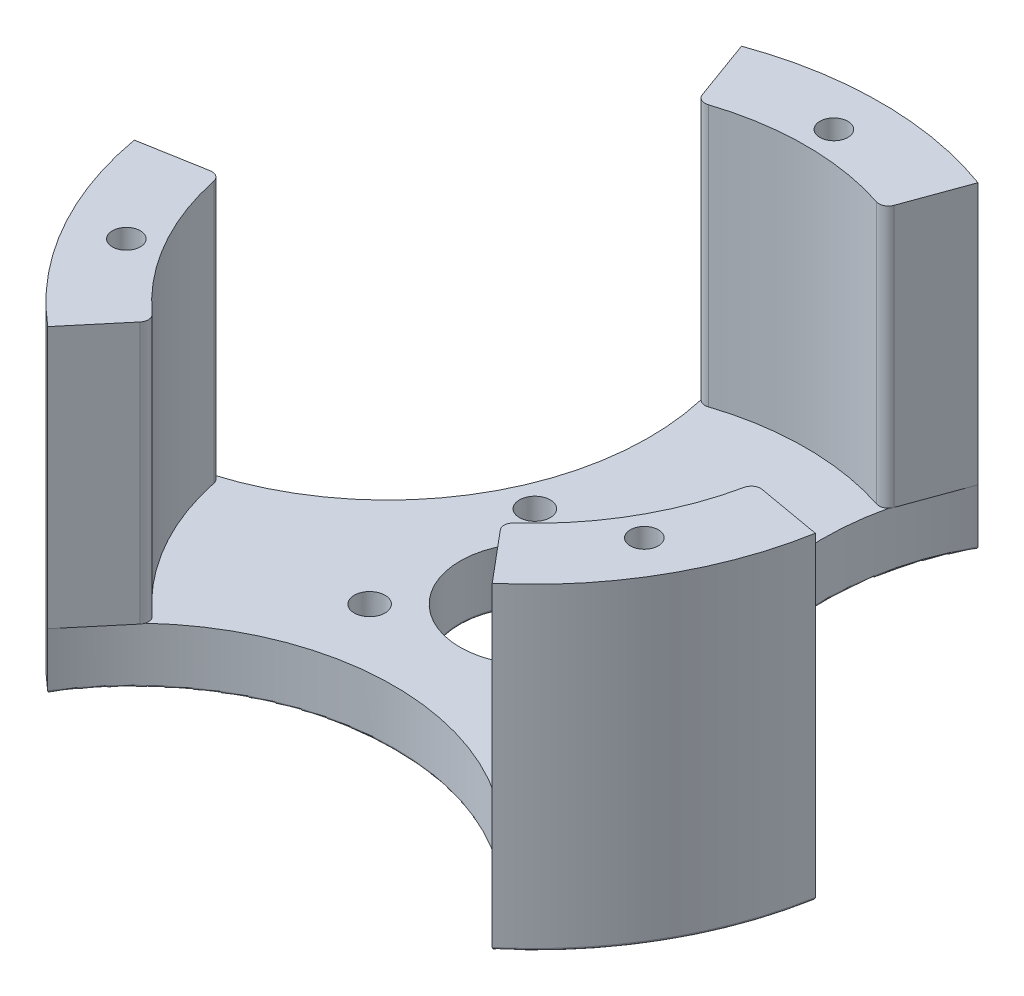
from build123d import *

# Parameters (mm, degrees)
SKETCH1_R           = 37
SKETCH1_R_2         = 1.65
BOSS_EXTRUDE1_DEPTH = 6
SKETCH2_R           = 1.5
BOSS_EXTRUDE2_DEPTH = 28
SKETCH16_R          = 1.5
CUT_EXTRUDE9_DEPTH  = 63.401923047
CIRPATTERN1_COUNT   = 3
SKETCH3_R           = 8
CUT_EXTRUDE1_DEPTH  = 10
SKETCH4_R           = 3.5
CUT_EXTRUDE2_DEPTH  = 3
SKETCH5_R           = 27.977706125
CUT_EXTRUDE3_DEPTH  = 60.3464405
CIRPATTERN2_COUNT   = 3
FILLET1_R           = 0.25
FILLET2_R           = 1


with BuildPart() as part:
    # Sketch1 → Boss-Extrude1 (new body)
    with BuildSketch(Plane(origin=(0, 0, 0), x_dir=(1, 0, 0), z_dir=(0, 1, 0))):
        with Locations(Location((0, 0, 0), (0, 0, 270))):
            Circle(SKETCH1_R)
        with Locations(Location((-8.838834765, 8.838834765, 0), (0, 0, 270))):
            Circle(SKETCH1_R_2, mode=Mode.SUBTRACT)
        with Locations(Location((8.838834765, 8.838834765, 0), (0, 0, 270))):
            Circle(SKETCH1_R_2, mode=Mode.SUBTRACT)
        with Locations(Location((8.838834765, -8.838834765, 0), (0, 0, 270))):
            Circle(SKETCH1_R_2, mode=Mode.SUBTRACT)
        with Locations(Location((-8.838834765, -8.838834765, 0), (0, 0, 270))):
            Circle(SKETCH1_R_2, mode=Mode.SUBTRACT)
    extrude(amount=BOSS_EXTRUDE1_DEPTH)

    # Sketch2 → Boss-Extrude2 (add)
    with BuildSketch(Plane(origin=(0, 6, 0), x_dir=(1, 0, 0), z_dir=(0, 1, 0))):
        with BuildLine():
            Line((-12.654745303, 34.768626969), (-9.918584156, 27.251086003))
            ThreePointArc((-9.918584156, 27.251086003), (0, 29), (9.918584156, 27.251086003))
            Line((9.918584156, 27.251086003), (12.654745303, 34.768626969))
            ThreePointArc((12.654745303, 34.768626969), (0, 37), (-12.654745303, 34.768626969))
        make_face()
        with Locations(Location((0, 32, 0), (0, 0, 270))):
            Circle(SKETCH2_R, mode=Mode.SUBTRACT)
    boss_extrude2 = extrude(amount=BOSS_EXTRUDE2_DEPTH)

    # Sketch16 → Cut-Extrude9 (cut, through all)
    with BuildSketch(Plane(origin=(0, 34, 0), x_dir=(1, 0, 0), z_dir=(0, 1, 0))):
        with Locations(Location((0, 32, 0), (0, 0, 270))):
            Circle(SKETCH16_R)
    cut_extrude9 = extrude(amount=-CUT_EXTRUDE9_DEPTH, mode=Mode.SUBTRACT)

    # CirPattern1: Boss-Extrude2, Cut-Extrude9 ×3 about axis
    cirpattern1_axis = Axis((0, 0, 0), (0, 1, 0))
    add([boss_extrude2.rotate(cirpattern1_axis, i * 360 / CIRPATTERN1_COUNT) for i in range(1, CIRPATTERN1_COUNT)])
    add([cut_extrude9.rotate(cirpattern1_axis, i * 360 / CIRPATTERN1_COUNT) for i in range(1, CIRPATTERN1_COUNT)], mode=Mode.SUBTRACT)

    # Sketch3 → Cut-Extrude1 (cut)
    with BuildSketch(Plane(origin=(0, 6, 0), x_dir=(1, 0, 0), z_dir=(0, 1, 0))):
        with Locations(Location((0, 0, 0), (0, 0, 270))):
            Circle(SKETCH3_R)
    extrude(amount=-CUT_EXTRUDE1_DEPTH, mode=Mode.SUBTRACT)

    # Sketch4 → Cut-Extrude2 (cut)
    with BuildSketch(Plane.XZ):
        with Locations(Location((8.838834765, 8.838834765, 0), (0, 0, 270))):
            Circle(SKETCH4_R)
        with Locations(Location((8.838834765, -8.838834765, 0), (0, 0, 270))):
            Circle(SKETCH4_R)
        with Locations(Location((-8.838834765, -8.838834765, 0), (0, 0, 270))):
            Circle(SKETCH4_R)
        with Locations(Location((-8.838834765, 8.838834765, 0), (0, 0, 270))):
            Circle(SKETCH4_R)
    extrude(amount=-CUT_EXTRUDE2_DEPTH, mode=Mode.SUBTRACT)

    # Sketch5 → Cut-Extrude3 (cut, through all)
    with BuildSketch(Plane(origin=(0, 6, 0), x_dir=(1, 0, 0), z_dir=(0, 1, 0))):
        with Locations((37.30702387, 21.539220274)):
            Circle(SKETCH5_R)
    cut_extrude3 = extrude(amount=-CUT_EXTRUDE3_DEPTH, mode=Mode.SUBTRACT)

    # CirPattern2: Cut-Extrude3 ×3 about axis
    cirpattern2_axis = Axis((0, 0, 0), (0, 1, 0))
    for i in range(1, CIRPATTERN2_COUNT):
        add(cut_extrude3.rotate(cirpattern2_axis, i * 360 / CIRPATTERN2_COUNT), mode=Mode.SUBTRACT)

    # Fillet1
    fillet1_edges = [part.edges().sort_by_distance(p)[0] for p in [
        (8.838834765, 0, 12.338834765),
        (5.642491698, 0, -7.41286457),
        (0, 0, -37),
        (22.281889782, 0, 2.061571782),
        (9.380753213, 0, -23.234934645),
        (-5.642491698, 0, -7.41286457),
        (-32.04293994, 0, 18.5),
        (32.04293994, 0, 18.5),
        (-9.380753213, 0, -23.234934645),
        (-22.281889782, 0, 2.061571782),
        (0, 0, 15.100734422),
        (0, 0, -33.5),
        (-29.011851027, 0, 16.75),
        (29.011851027, 0, 16.75),
        (0, 0, -8),
        (-8.838834765, 0, 12.338834765),
    ]]
    fillet(fillet1_edges, radius=FILLET1_R)

    # Fillet2
    # the kernel refuses this fillet: 1 mm, written as the material it takes off along each edge
    with BuildSketch(Plane(origin=(-9.918584156, 6, -27.251086003), x_dir=(-0.34202014332566266, 0, -0.9396926207859105), z_dir=(0, 1, 0)), Plane(origin=(-18.640840681, 6, 22.21528885), x_dir=(-0.6427876096865424, 0, 0.7660444431189755), z_dir=(0, 1, 0))) as fillet2_piece_1:
        with BuildLine():
            CenterArc((0.983328701, -1), FILLET2_R, 90, 88.089786828)
            ThreePointArc((-0.016115589, -0.966666667), (-0.004029177, -0.483400496), (0, 0))
            Line((0, 0), (0.983328701, 0))
        make_face()
    extrude(amount=30.458321753, mode=Mode.SUBTRACT)
    with BuildSketch(Plane(origin=(9.918584156, 6, -27.251086003), x_dir=(0.3420201433256693, 0, -0.9396926207859081), z_dir=(0, 1, 0)), Plane(origin=(-28.559424837, 6, 5.035797152), x_dir=(-0.9848077530122081, 0, 0.17364817766692994), z_dir=(0, 1, 0))) as fillet2_piece_2:
        with BuildLine():
            CenterArc((0.983328701, 1), FILLET2_R, 181.910213172, 88.089786828)
            ThreePointArc((-0.016115589, 0.966666667), (-0.004029177, 0.483400496), (0, 0))
            Line((0, 0), (0.983328701, 0))
        make_face()
    extrude(amount=30.458321753, mode=Mode.SUBTRACT)
    with BuildSketch(Plane(origin=(28.559424837, 6, 5.035797152), x_dir=(-0.1900397947920235, 0, 0.9817763881838907), z_dir=(0, 1, 0))) as fillet2_piece_3:
        with BuildLine():
            CenterArc((0.983469974, 0.999861063), FILLET2_R, 180.955106586, 88.089786828)
            Line((-0.016391089, 0.98319208), (0, 0))
            ThreePointArc((0, 0), (0.483400496, 0.004029177), (0.966800991, 0))
        make_face()
    extrude(amount=30.458321753, mode=Mode.SUBTRACT)
    with BuildSketch(Plane(origin=(18.640840681, 6, 22.21528885), x_dir=(0.755223395606972, 0, -0.655467484111817), z_dir=(0, 1, 0))) as fillet2_piece_4:
        with BuildLine():
            CenterArc((0.983469974, -0.999861063), FILLET2_R, 90.955106586, 88.089786828)
            Line((-0.016391089, -0.98319208), (0, 0))
            ThreePointArc((0, 0), (0.483400496, -0.004029177), (0.966800991, 0))
        make_face()
    extrude(amount=30.458321753, mode=Mode.SUBTRACT)


solid = part.part
